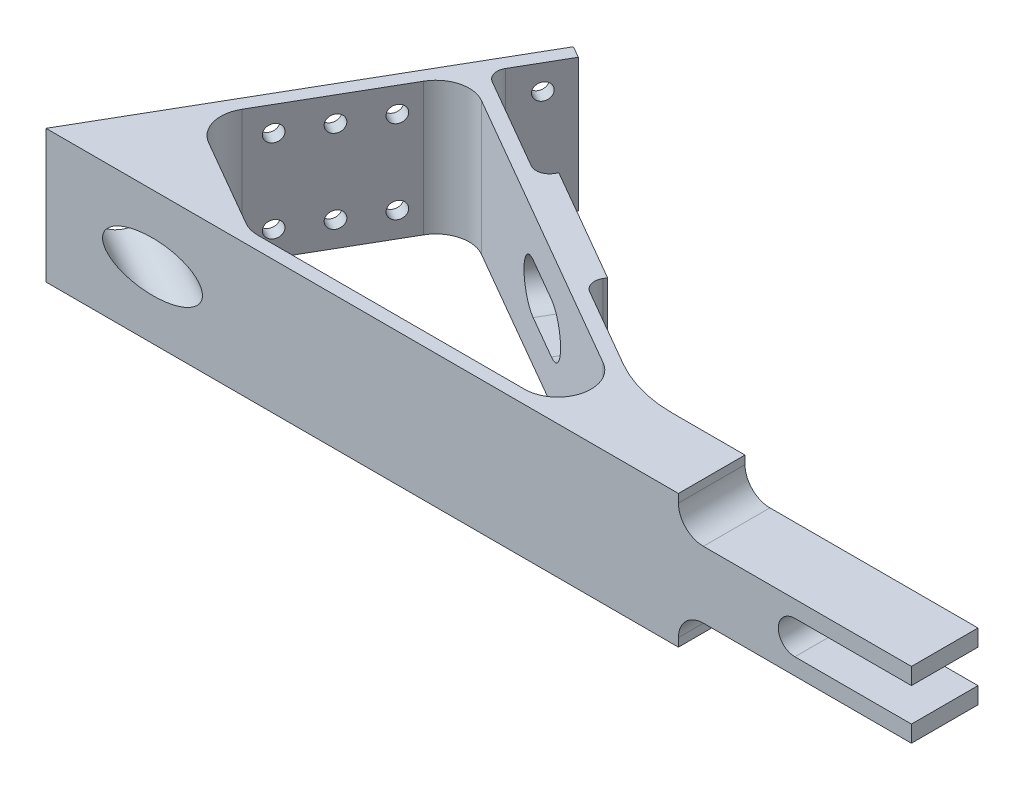
from build123d import *

# Parameters (mm, degrees)
BOSS_EXTRUDE1_DEPTH                     = 20
CUT_EXTRUDE1_DEPTH                      = 20
CBORE_FOR_M5_HEX_HEAD_BOLT1_D           = 7.5
CBORE_FOR_M5_HEX_HEAD_BOLT1_DEPTH       = 112.583668517
CBORE_FOR_M5_HEX_HEAD_BOLT1_CBORE_D     = 11.25
CBORE_FOR_M5_HEX_HEAD_BOLT1_CBORE_DEPTH = 1.25
CBORE_FOR_M5_HEX_HEAD_BOLT1_TIP         = 2.253227321
CUT_EXTRUDE2_DEPTH                      = 10
SKETCH6_W                               = 20
SKETCH6_H                               = 20
BOSS_EXTRUDE2_DEPTH                     = 2.5
FILLET1_R                               = 2
FILLET2_R                               = 20
CUT_EXTRUDE3_DEPTH                      = 4.5
HOLE1_OUTLINE_R                         = 1.25
HOLE1_DEPTH                             = 2
LPATTERN1_COUNT                         = 3
LPATTERN1_PITCH                         = 6.8
LPATTERN1_COUNT_DIR2                    = 2
LPATTERN1_PITCH_DIR2                    = 12.5
LPATTERN2_COUNT                         = 2
LPATTERN2_PITCH                         = 29.6
LPATTERN2_COUNT_DIR2                    = 2
LPATTERN2_PITCH_DIR2                    = 12.5


# Read off the part's stored shape, not the designer's step: Hole1
with BuildPart() as part:
    # Sketch1 → Boss-Extrude1 (new body)
    with BuildSketch(Plane(origin=(0, 0, 0), x_dir=(1, 0, 0), z_dir=(0, 1, 0))):
        Polygon((29, 50.229473419), (0, 0), (130, 0), (130, 10), (78.679491924, 10), (25.732050808, 40.569219382), (30.732050808, 49.229473419), align=None)
    extrude(amount=BOSS_EXTRUDE1_DEPTH)

    # Sketch2 → Cut-Extrude1 (cut)
    with BuildSketch(Plane(origin=(0, 20, 0), x_dir=(1, 0, 0), z_dir=(0, 1, 0))):
        with BuildLine():
            Line((29.875644347, 2), (69.875644347, 2))
            ThreePointArc((69.875644347, 2), (74.705273478, 5.705904774), (72.375644347, 11.330127019))
            Line((72.375644347, 11.330127019), (29.062177826, 36.337168574))
            ThreePointArc((29.062177826, 36.337168574), (25.268082601, 36.836670687), (22.232050808, 34.507041555))
            Line((22.232050808, 34.507041555), (12.232050808, 17.186533479))
            ThreePointArc((12.232050808, 17.186533479), (11.732548695, 13.392438254), (14.062177826, 10.356406461))
            Line((14.062177826, 10.356406461), (27.375644347, 2.669872981))
            ThreePointArc((27.375644347, 2.669872981), (28.581549122, 2.170370869), (29.875644347, 2))
        make_face()
    extrude(amount=-CUT_EXTRUDE1_DEPTH, mode=Mode.SUBTRACT)

    # CBORE for M5 Hex Head Bolt1
    with Locations(Plane(origin=(0, 0, 0), x_dir=(-0.5000000000000042, 0, 0.8660254037844363), z_dir=(-0.8660254037844362, 0, -0.5000000000000041))):
        with Locations((-8, 10)):
            CounterBoreHole(CBORE_FOR_M5_HEX_HEAD_BOLT1_D / 2, CBORE_FOR_M5_HEX_HEAD_BOLT1_CBORE_D / 2, CBORE_FOR_M5_HEX_HEAD_BOLT1_CBORE_DEPTH, depth=CBORE_FOR_M5_HEX_HEAD_BOLT1_DEPTH)
            with Locations((0, 0, -(CBORE_FOR_M5_HEX_HEAD_BOLT1_DEPTH + CBORE_FOR_M5_HEX_HEAD_BOLT1_TIP / 2))):  # 118° drill point
                Cone(0, CBORE_FOR_M5_HEX_HEAD_BOLT1_D / 2, CBORE_FOR_M5_HEX_HEAD_BOLT1_TIP, mode=Mode.SUBTRACT)

    # Sketch5 → Cut-Extrude2 (cut)
    with BuildSketch(Plane.XY):
        with BuildLine():
            Line((95, 20), (130, 20))
            Line((130, 20), (130, 15))
            Line((130, 15), (98.75, 15))
            ThreePointArc((98.75, 15), (96.098349571, 16.098349571), (95, 18.75))
            Line((95, 18.75), (95, 20))
        make_face()
        with BuildLine():
            Line((95, 0), (130, 0))
            Line((130, 0), (130, 5))
            Line((130, 5), (98.75, 5))
            ThreePointArc((98.75, 5), (96.098349571, 3.901650429), (95, 1.25))
            Line((95, 1.25), (95, 0))
        make_face()
        with BuildLine():
            Line((130, 12.5), (112.5, 12.5))
            ThreePointArc((112.5, 12.5), (110, 10), (112.5, 7.5))
            Line((112.5, 7.5), (130, 7.5))
            Line((130, 7.5), (130, 12.5))
        make_face()
    extrude(amount=-CUT_EXTRUDE2_DEPTH, mode=Mode.SUBTRACT)

    # Sketch6 → Boss-Extrude2 (add)
    with BuildSketch(Plane(origin=(24, 0, -41.569219382), x_dir=(-0.8660254037844363, 0, -0.5000000000000042), z_dir=(0.5000000000000042, 0, -0.8660254037844363))):
        with Locations((-32, 10)):
            Rectangle(SKETCH6_W, SKETCH6_H)
    extrude(amount=BOSS_EXTRUDE2_DEPTH)

    # Fillet1
    fillet1_edges = [part.edges().sort_by_distance(p)[0] for p in [
        (60.373066959, 10, -20.569219382),
        (43.052558883, 10, -30.569219382),
        (25.732050808, 10, -40.569219382),
    ]]
    fillet(fillet1_edges, radius=FILLET1_R)

    # Fillet2
    fillet2_edges = [part.edges().sort_by_distance(p)[0] for p in [
        (78.679491924, 10, -10),
    ]]
    fillet(fillet2_edges, radius=FILLET2_R)

    # Sketch7 → Cut-Extrude3 (cut)
    with BuildSketch(Plane(origin=(25.25, 0, -43.734282891), x_dir=(-0.8660254037844363, 0, -0.5000000000000042), z_dir=(0.5000000000000042, 0, -0.8660254037844363))):
        with BuildLine():
            Line((-35.75, 13.75), (-28.25, 13.75))
            ThreePointArc((-28.25, 13.75), (-24.5, 10), (-28.25, 6.25))
            Line((-28.25, 6.25), (-35.75, 6.25))
            ThreePointArc((-35.75, 6.25), (-39.5, 10), (-35.75, 13.75))
        make_face()
    extrude(amount=-CUT_EXTRUDE3_DEPTH, mode=Mode.SUBTRACT)

    # Hole1 outline → Hole1 (cut)
    with BuildSketch(Plane(origin=(0, 0, 0), x_dir=(0.500000000000004, 0, -0.8660254037844363), z_dir=(0.8660254037844363, 0, 0.5000000000000042))):
        with Locations((24.5, 16.25)):
            Circle(HOLE1_OUTLINE_R)
    hole1 = extrude(amount=HOLE1_DEPTH, mode=Mode.SUBTRACT)

    # LPattern1: Hole1 3 × 2
    with Locations(*[Vector(0.5000000000000041, 0, -0.8660254037844363) * (i * LPATTERN1_PITCH) + Vector(0, -1, 0) * (j * LPATTERN1_PITCH_DIR2) for i in range(LPATTERN1_COUNT) for j in range(LPATTERN1_COUNT_DIR2) if (i, j) != (0, 0)]):
        add(hole1, mode=Mode.SUBTRACT)

    # LPattern2: Hole1 2 × 2, 1 skipped
    with Locations(*[Vector(0.5000000000000041, 0, -0.8660254037844363) * (i * LPATTERN2_PITCH) + Vector(0, -1, 0) * (j * LPATTERN2_PITCH_DIR2) for i in range(LPATTERN2_COUNT) for j in range(LPATTERN2_COUNT_DIR2) if (i, j) not in ((0, 0), (0, 1))]):
        add(hole1, mode=Mode.SUBTRACT)


solid = part.part
